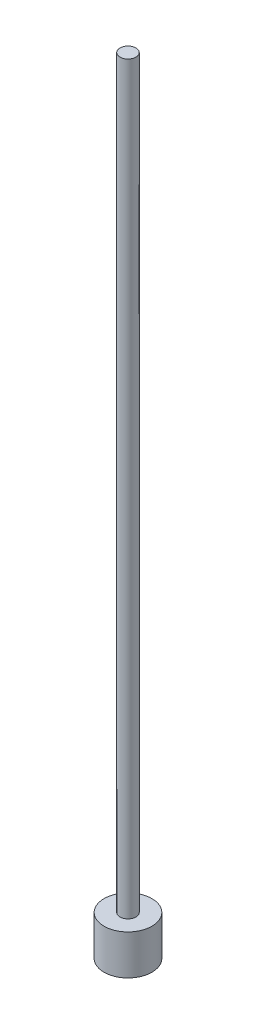
from build123d import *

# Parameters (mm, degrees)
SKETCH1_R           = 30
BOSS_EXTRUDE1_DEPTH = 2800
SKETCH2_R           = 90
BOSS_EXTRUDE2_DEPTH = 150


with BuildPart() as part:
    # Sketch1 → Boss-Extrude1 (new body)
    with BuildSketch(Plane(origin=(0, 0, 0), x_dir=(1, 0, 0), z_dir=(0, 1, 0))):
        Circle(SKETCH1_R)
    extrude(amount=BOSS_EXTRUDE1_DEPTH)


with BuildPart() as body_2:
    # Sketch2 → Boss-Extrude2 (new body)
    with BuildSketch(Plane(origin=(0, 0, 0), x_dir=(1, 0, 0), z_dir=(0, 1, 0))):
        Circle(SKETCH2_R)
    extrude(amount=-BOSS_EXTRUDE2_DEPTH)


solid = Compound([part.part, body_2.part])
